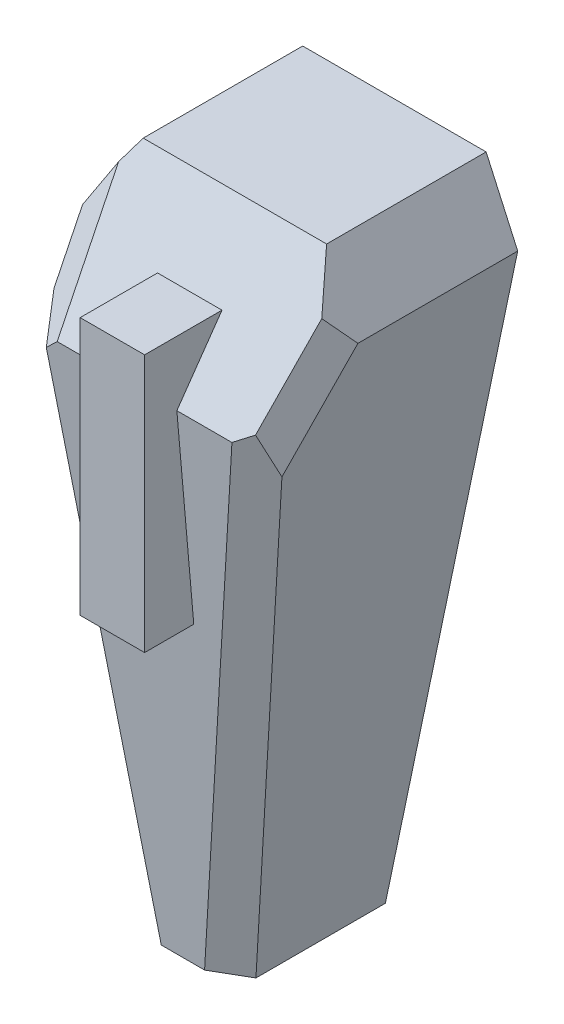
from build123d import *
from OCP.BRepFilletAPI import BRepFilletAPI_MakeChamfer

# Parameters (mm, degrees)
SKETCH1_W           = 10.16
SKETCH1_H           = 25.4
BOSS_EXTRUDE1_DEPTH = 10.16
CHAMFER1_SIZE       = 5.08
CHAMFER1_SIZE2      = 3.557054294
CHAMFER6_SIZE       = 22.86
CHAMFER6_SIZE2      = 3.212763481
CHAMFER7_SIZE       = 22.86
CHAMFER7_SIZE2      = 3.212763481
CHAMFER10_SIZE2     = 1.466469684
CHAMFER10_SIZE      = 2.54
CHAMFER11_SIZE2     = 2.54
CHAMFER11_SIZE      = 1.466469684
BOSS_EXTRUDE2_DEPTH = 11.43
CHAMFER12_SIZE      = 20.32
CHAMFER12_SIZE_2    = 1.777769643
CHAMFER13_SIZE      = 1.27
CHAMFER13_SIZE2     = 0.703075315
CHAMFER13_SIZE2_2   = 0.738460687
CHAMFER14_SIZE      = 1.27
CHAMFER14_SIZE2     = 0.703075315
CHAMFER14_SIZE2_2   = 0.738460687
CHAMFER15_SIZE      = 29.032332849
CHAMFER15_SIZE_2    = 2.54
SCALE1_SCALE        = 1.5
BOSS_EXTRUDE4_DEPTH = 0.254


# Some blends are built 0.0001 mm under size
with BuildPart() as part:
    # Sketch1 → Boss-Extrude1 (new body)
    with BuildSketch(Plane.XY):
        with Locations((5.08, 12.7)):
            Rectangle(SKETCH1_W, SKETCH1_H)
    extrude(amount=BOSS_EXTRUDE1_DEPTH)

    # Chamfer1
    chamfer1_edges = [part.edges().sort_by_distance(p)[0] for p in [
        (5.08, 25.4, 10.16),
    ]]
    chamfer1_side = [part.faces().sort_by_distance(p)[0] for p in [
        (5.08, 12.7, 10.16),
    ]]
    chamfer(chamfer1_edges, length=CHAMFER1_SIZE, length2=CHAMFER1_SIZE2, reference=chamfer1_side[0])

    # Chamfer6
    chamfer6_edges = [part.edges().sort_by_distance(p)[0] for p in [
        (0, 0, 5.08),
    ]]
    chamfer6_side = [part.faces().sort_by_distance(p)[0] for p in [
        (0, 12.300671821, 4.93871201),
    ]]
    chamfer(chamfer6_edges, length=CHAMFER6_SIZE, length2=CHAMFER6_SIZE2, reference=chamfer6_side[0])

    # Chamfer7
    chamfer7_edges = [part.edges().sort_by_distance(p)[0] for p in [
        (10.16, 0, 5.08),
    ]]
    chamfer7_side = [part.faces().sort_by_distance(p)[0] for p in [
        (10.16, 12.300671821, 4.93871201),
    ]]
    chamfer(chamfer7_edges, length=CHAMFER7_SIZE, length2=CHAMFER7_SIZE2, reference=chamfer7_side[0])

    # Chamfer10
    chamfer10_edges = [part.edges().sort_by_distance(p)[0] for p in [
        (0, 25.4, 3.301472853),
    ]]
    chamfer10_side = [part.faces().sort_by_distance(p)[0] for p in [
        (0, 25.370670606, 3.301472853),
    ]]
    chamfer(chamfer10_edges, length=CHAMFER10_SIZE - 0.0001, length2=CHAMFER10_SIZE2 - 0.0001, reference=chamfer10_side[0])  # a hair under: the kernel refuses the full size

    # Chamfer11
    chamfer11_edges = [part.edges().sort_by_distance(p)[0] for p in [
        (10.16, 25.4, 3.301472853),
    ]]
    chamfer11_side = [part.faces().sort_by_distance(p)[0] for p in [
        (10.130670606, 25.4, 3.301472853),
    ]]
    chamfer(chamfer11_edges, length=CHAMFER11_SIZE - 0.0001, length2=CHAMFER11_SIZE2 - 0.0001, reference=chamfer11_side[0])  # a hair under: the kernel refuses the full size

    # Sketch2 → Boss-Extrude2 (add)
    with BuildSketch(Plane(origin=(0, 0, 0), x_dir=(-1, 0, 0), z_dir=(0, 0, -1))):
        Polygon((-5.08, 22.86), (-3.81, 22.86), (-3.81, 12.7), (-5.08, 12.7), (-6.35, 12.7), (-6.35, 22.86), align=None)
    extrude(amount=-BOSS_EXTRUDE2_DEPTH)

    # Chamfer12
    # the kernel refuses this chamfer: 20.32, 1.777769643 mm, written as the material it takes off along each edge
    with BuildSketch(Plane(origin=(-49.611801021, 0, 10.16), x_dir=(0, 0.9999943799678764, 0.003352615794033212), z_dir=(1, 0, 0))) as chamfer12_piece_1_section:
        Polygon((CHAMFER12_SIZE * 0.999994379968, -CHAMFER12_SIZE * 0.00335261579403), (-CHAMFER12_SIZE_2 * 0.00335261579374, -CHAMFER12_SIZE_2 * 0.999994379882), (0, 0), align=None)
    chamfer12_piece_1 = extrude(amount=109.383602042, mode=Mode.PRIVATE)
    chamfer12_piece_1 = split(chamfer12_piece_1, bisect_by=Plane(origin=(3.81, 16.274065634, 10.201831789), z_dir=(-1, 0, 0)), keep=Keep.TOP, mode=Mode.PRIVATE)
    chamfer12_piece_1 = split(chamfer12_piece_1, bisect_by=Plane(origin=(-22.90090051, 12.7, 10.201831789), z_dir=(0, 1, 0)), keep=Keep.TOP, mode=Mode.PRIVATE)
    add(chamfer12_piece_1, mode=Mode.SUBTRACT)
    with BuildSketch(Plane(origin=(-49.611801021, 0, 10.16), x_dir=(0, 0.9999943799678764, 0.003352615794033212), z_dir=(1, 0, 0))) as chamfer12_piece_2_section:
        Polygon((CHAMFER12_SIZE * 0.999994379968, -CHAMFER12_SIZE * 0.00335261579403), (-CHAMFER12_SIZE_2 * 0.00335261579374, -CHAMFER12_SIZE_2 * 0.999994379882), (0, 0), align=None)
    chamfer12_piece_2 = extrude(amount=109.383602042, mode=Mode.PRIVATE)
    chamfer12_piece_2 = split(chamfer12_piece_2, bisect_by=Plane(origin=(3.81, 5.349834898, 9.691469829), z_dir=(-1, 0, 0)), keep=Keep.TOP, mode=Mode.PRIVATE)
    chamfer12_piece_2 = split(chamfer12_piece_2, bisect_by=Plane(origin=(-22.90090051, 12.7, 9.691469829), z_dir=(0, -1, 0)), keep=Keep.TOP, mode=Mode.PRIVATE)
    add(chamfer12_piece_2, mode=Mode.SUBTRACT)
    with BuildSketch(Plane(origin=(-49.611801021, 0, 10.16), x_dir=(0, 0.9999943799678764, 0.003352615794033212), z_dir=(1, 0, 0))) as chamfer12_piece_3_section:
        Polygon((CHAMFER12_SIZE * 0.999994379968, -CHAMFER12_SIZE * 0.00335261579403), (-CHAMFER12_SIZE_2 * 0.00335261579374, -CHAMFER12_SIZE_2 * 0.999994379882), (0, 0), align=None)
    chamfer12_piece_3 = extrude(amount=109.383602042, mode=Mode.PRIVATE)
    chamfer12_piece_3 = split(chamfer12_piece_3, bisect_by=Plane(origin=(3.81, 5.349834898, 9.691469829), z_dir=(1, 0, 0)), keep=Keep.TOP, mode=Mode.PRIVATE)
    chamfer12_piece_3 = split(chamfer12_piece_3, bisect_by=Plane(origin=(5.08, 12.7, 9.691469829), z_dir=(0, -1, 0)), keep=Keep.TOP, mode=Mode.PRIVATE)
    chamfer12_piece_3 = split(chamfer12_piece_3, bisect_by=Plane(origin=(6.35, 5.349834898, 9.691469829), z_dir=(-1, 0, 0)), keep=Keep.TOP, mode=Mode.PRIVATE)
    add(chamfer12_piece_3, mode=Mode.SUBTRACT)
    with BuildSketch(Plane(origin=(-49.611801021, 0, 10.16), x_dir=(0, 0.9999943799678764, 0.003352615794033212), z_dir=(1, 0, 0))) as chamfer12_piece_4_section:
        Polygon((CHAMFER12_SIZE * 0.999994379968, -CHAMFER12_SIZE * 0.00335261579403), (-CHAMFER12_SIZE_2 * 0.00335261579374, -CHAMFER12_SIZE_2 * 0.999994379882), (0, 0), align=None)
    chamfer12_piece_4 = extrude(amount=109.383602042, mode=Mode.PRIVATE)
    chamfer12_piece_4 = split(chamfer12_piece_4, bisect_by=Plane(origin=(33.06090051, 12.7, 10.201831789), z_dir=(0, 1, 0)), keep=Keep.TOP, mode=Mode.PRIVATE)
    chamfer12_piece_4 = split(chamfer12_piece_4, bisect_by=Plane(origin=(6.35, 16.274065634, 10.201831789), z_dir=(1, 0, 0)), keep=Keep.TOP, mode=Mode.PRIVATE)
    add(chamfer12_piece_4, mode=Mode.SUBTRACT)
    with BuildSketch(Plane(origin=(-49.611801021, 0, 10.16), x_dir=(0, 0.9999943799678764, 0.003352615794033212), z_dir=(1, 0, 0))) as chamfer12_piece_5_section:
        Polygon((CHAMFER12_SIZE * 0.999994379968, -CHAMFER12_SIZE * 0.00335261579403), (-CHAMFER12_SIZE_2 * 0.00335261579374, -CHAMFER12_SIZE_2 * 0.999994379882), (0, 0), align=None)
    chamfer12_piece_5 = extrude(amount=109.383602042, mode=Mode.PRIVATE)
    chamfer12_piece_5 = split(chamfer12_piece_5, bisect_by=Plane(origin=(33.06090051, 12.7, 9.691469829), z_dir=(0, -1, 0)), keep=Keep.TOP, mode=Mode.PRIVATE)
    chamfer12_piece_5 = split(chamfer12_piece_5, bisect_by=Plane(origin=(6.35, 5.349834898, 9.691469829), z_dir=(1, 0, 0)), keep=Keep.TOP, mode=Mode.PRIVATE)
    add(chamfer12_piece_5, mode=Mode.SUBTRACT)

    # Chamfer13: one chamfer whose edges measure the first distance from different faces: ONE call of the kernel's chamfer builder (chamfer() names one face for all edges)
    chamfer13_edges_1 = [part.edges().sort_by_distance(p)[0] for p in [
        (0.17848686, 21.59, 9.270736426),
    ]]
    chamfer13_side_1 = [part.faces().sort_by_distance(p)[0] for p in [
        (5.08, 22.944432903, 8.322352298),
    ]]
    chamfer13_edges_2 = [part.edges().sort_by_distance(p)[0] for p in [
        (1.784868601, 10.16, 9.271115179),
    ]]
    chamfer13_side_2 = [part.faces().sort_by_distance(p)[0] for p in [
        (1.566458565, 11.714068156, 4.649741863),
    ]]
    chamfer13 = BRepFilletAPI_MakeChamfer(part.part.solid().wrapped)
    for e in chamfer13_edges_1:
        chamfer13.Add(CHAMFER13_SIZE, CHAMFER13_SIZE2, e.wrapped, chamfer13_side_1[0].wrapped)  # the first distance lies on this face
    for e in chamfer13_edges_2:
        chamfer13.Add(CHAMFER13_SIZE, CHAMFER13_SIZE2_2, e.wrapped, chamfer13_side_2[0].wrapped)  # the first distance lies on this face
    add(Compound.cast(chamfer13.Shape()), mode=Mode.REPLACE)

    # Chamfer14: one chamfer whose edges measure the first distance from different faces: ONE call of the kernel's chamfer builder (chamfer() names one face for all edges)
    chamfer14_edges_1 = [part.edges().sort_by_distance(p)[0] for p in [
        (9.98151314, 21.59, 9.270736426),
    ]]
    chamfer14_side_1 = [part.faces().sort_by_distance(p)[0] for p in [
        (8.593541435, 11.714068156, 4.649741863),
    ]]
    chamfer14_edges_2 = [part.edges().sort_by_distance(p)[0] for p in [
        (8.375131399, 10.16, 9.271115179),
    ]]
    chamfer14_side_2 = [part.faces().sort_by_distance(p)[0] for p in [
        (5.530551527, 10.889375046, 9.334927227),
    ]]
    chamfer14 = BRepFilletAPI_MakeChamfer(part.part.solid().wrapped)
    for e in chamfer14_edges_1:
        chamfer14.Add(CHAMFER14_SIZE, CHAMFER14_SIZE2, e.wrapped, chamfer14_side_1[0].wrapped)  # the first distance lies on this face
    for e in chamfer14_edges_2:
        chamfer14.Add(CHAMFER14_SIZE, CHAMFER14_SIZE2_2, e.wrapped, chamfer14_side_2[0].wrapped)  # the first distance lies on this face
    add(Compound.cast(chamfer14.Shape()), mode=Mode.REPLACE)

    # Chamfer15
    # the kernel refuses this chamfer: 29.032332849, 2.54 mm, written as the material it takes off along each edge
    with BuildSketch(Plane(origin=(-72.26067841, 0, 0), x_dir=(0, 0.9999943799678764, -0.0033526157940330635), z_dir=(1, 0, 0))) as chamfer15_piece_1:
        Polygon((CHAMFER15_SIZE * 0.999994379968, CHAMFER15_SIZE * 0.00335261579403), (-CHAMFER15_SIZE_2 * 0.00335261579403, CHAMFER15_SIZE_2 * 0.999994379968), (0, 0), align=None)
    extrude(amount=154.68135682, mode=Mode.SUBTRACT)


with BuildPart() as part_1:
    # Scale1: scaled about (5.081275253, 15.154751407, 5.333676916)
    add(part.part.scale(SCALE1_SCALE).moved(Location((-2.540637627, -7.577375703, -2.666838458))))


with BuildPart() as boss_extrude4_tool:
    # Sketch5 → Boss-Extrude4 (new body)
    with BuildSketch(Plane(origin=(0, 0.041695217, 0.476578517), x_dir=(-1, 0, 0), z_dir=(0, -0.08715574274765502, -0.9961946980917459))):
        Polygon((-8.031077325, 26.787369773), (-5.079362375, 26.787369773), (-2.127647425, 26.787369773), (-2.127647425, 17.698761839), (-8.031077325, 17.698761839), align=None)
    extrude(amount=BOSS_EXTRUDE4_DEPTH)


with BuildPart() as part_2:
    add(part_1.part)


with BuildPart() as part_3:
    # Boss-Extrude4: joined with boss_extrude4_tool
    add(part_2.part.fuse(boss_extrude4_tool.part, tol=0.00001))


solid = part_3.part
